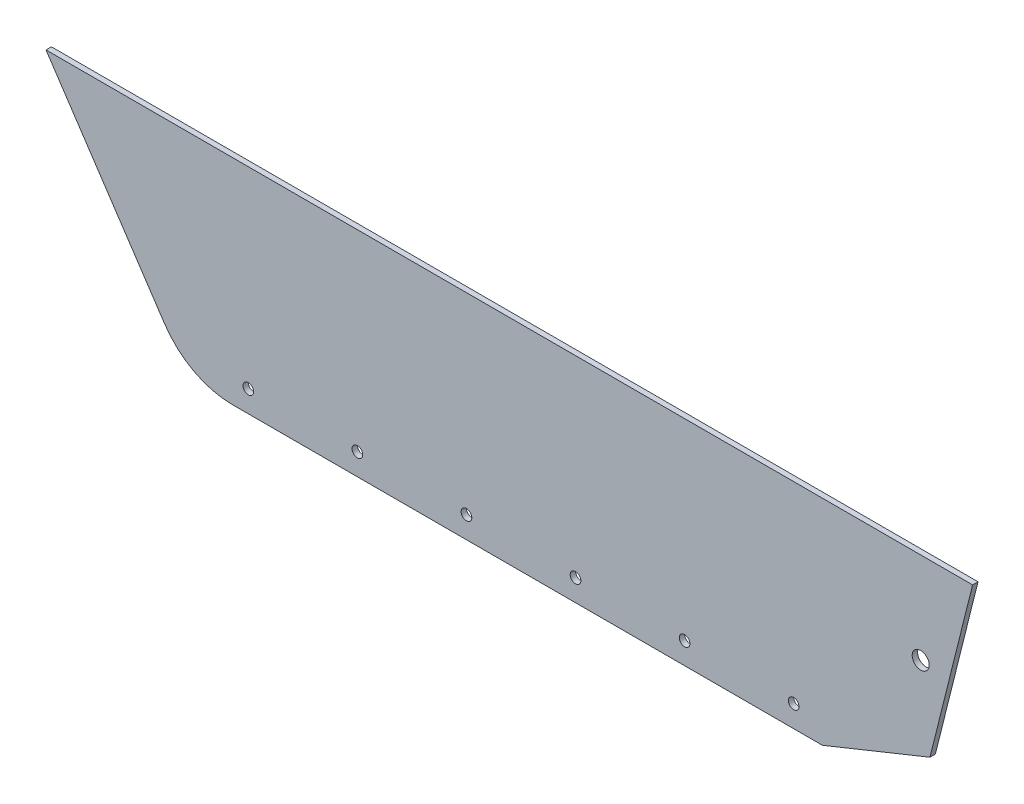
from build123d import *

# Parameters (mm, degrees)
BOSS_EXTRUDE1_DEPTH = 3.175
SKETCH1_4_R         = 3.125
CUT_EXTRUDE1_DEPTH  = 439.905857431
FILLET1_R           = 48
CUT_EXTRUDE3_DEPTH  = 10
CUT_EXTRUDE5_REACH  = 440.906
SKETCH11_R          = 5


with BuildPart() as part:
    # Sketch1 → Boss-Extrude1 (new body)
    with BuildSketch(Plane.XY):
        Polygon((-98.879411765, 3.850980392), (-31.879411765, -96.649019608), (366, -96.649019608), (403.120588235, -71.149019608), (428.120588235, 28.939617947), (-115.605170134, 28.939617947), align=None)
    extrude(amount=BOSS_EXTRUDE1_DEPTH)

    # Sketch1<4> → Cut-Extrude1 (cut, through all)
    with BuildSketch(Plane.XY):
        with Locations((3.120588235, -83.899019608)):
            Circle(SKETCH1_4_R)
        with Locations((67.120588235, -83.899019608)):
            Circle(SKETCH1_4_R)
        with Locations((131.120588235, -83.899019608)):
            Circle(SKETCH1_4_R)
        with Locations((195.120588235, -83.899019608)):
            Circle(SKETCH1_4_R)
        with Locations((259.120588235, -83.899019608)):
            Circle(SKETCH1_4_R)
        with Locations((323.120588235, -83.899019608)):
            Circle(SKETCH1_4_R)
    extrude(amount=CUT_EXTRUDE1_DEPTH, mode=Mode.SUBTRACT)

    # Fillet1
    fillet1_edges = [part.edges().sort_by_distance(p)[0] for p in [
        (-31.879411765, -96.649019608, 1.5875),
    ]]
    fillet(fillet1_edges, radius=FILLET1_R)

    # Sketch7 → Cut-Extrude3 (cut)
    with BuildSketch(Plane.XY.offset(3.175)):
        Polygon((403.120588235, -71.149019608), (340.005873473, -96.649019608), (366, -96.649019608), align=None)
    extrude(amount=-CUT_EXTRUDE3_DEPTH, mode=Mode.SUBTRACT)

    # Sketch11 → Cut-Extrude5 (cut, up to next)
    with BuildSketch(Plane(origin=(0, 0, 0), x_dir=(-1, 0, 0), z_dir=(0, 0, -1)), mode=Mode.PRIVATE) as cut_extrude5_sk1:
        with Locations((-397.678558137, -24.610405219)):
            Circle(SKETCH11_R)
    cut_extrude5_tool1 = extrude(cut_extrude5_sk1.sketch, amount=-CUT_EXTRUDE5_REACH, mode=Mode.PRIVATE) & part.part
    add(cut_extrude5_tool1.solids().sort_by_distance((397.678558, -24.610405, 0))[0], mode=Mode.SUBTRACT)


solid = part.part
